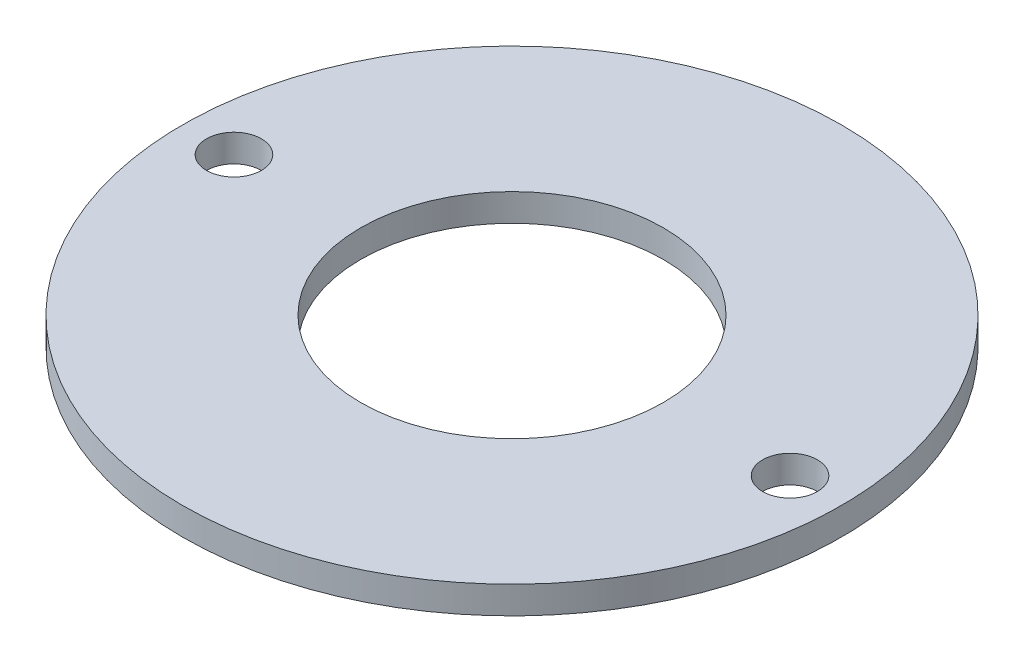
from build123d import *

# Parameters (mm, degrees)
SKETCH1_R           = 76.2
BOSS_EXTRUDE1_DEPTH = 6.35
SKETCH2_R           = 35
CUT_EXTRUDE1_DEPTH  = 6.35
SKETCH3_R           = 6.35
CUT_EXTRUDE2_DEPTH  = 10


with BuildPart() as part:
    # Sketch1 → Boss-Extrude1 (new body)
    with BuildSketch(Plane(origin=(0, 0, 0), x_dir=(1, 0, 0), z_dir=(0, 1, 0))):
        Circle(SKETCH1_R)
    extrude(amount=BOSS_EXTRUDE1_DEPTH)

    # Sketch2 → Cut-Extrude1 (cut)
    with BuildSketch(Plane(origin=(0, 6.35, 0), x_dir=(1, 0, 0), z_dir=(0, 1, 0))):
        Circle(SKETCH2_R)
    extrude(amount=-CUT_EXTRUDE1_DEPTH, mode=Mode.SUBTRACT)

    # Sketch3 → Cut-Extrude2 (cut)
    with BuildSketch(Plane(origin=(0, 6.35, 0), x_dir=(1, 0, 0), z_dir=(0, 1, 0))):
        with Locations((-64.2875, 0)):
            Circle(SKETCH3_R)
        with Locations((64.2875, 0)):
            Circle(SKETCH3_R)
    extrude(amount=-CUT_EXTRUDE2_DEPTH, mode=Mode.SUBTRACT)


solid = part.part
